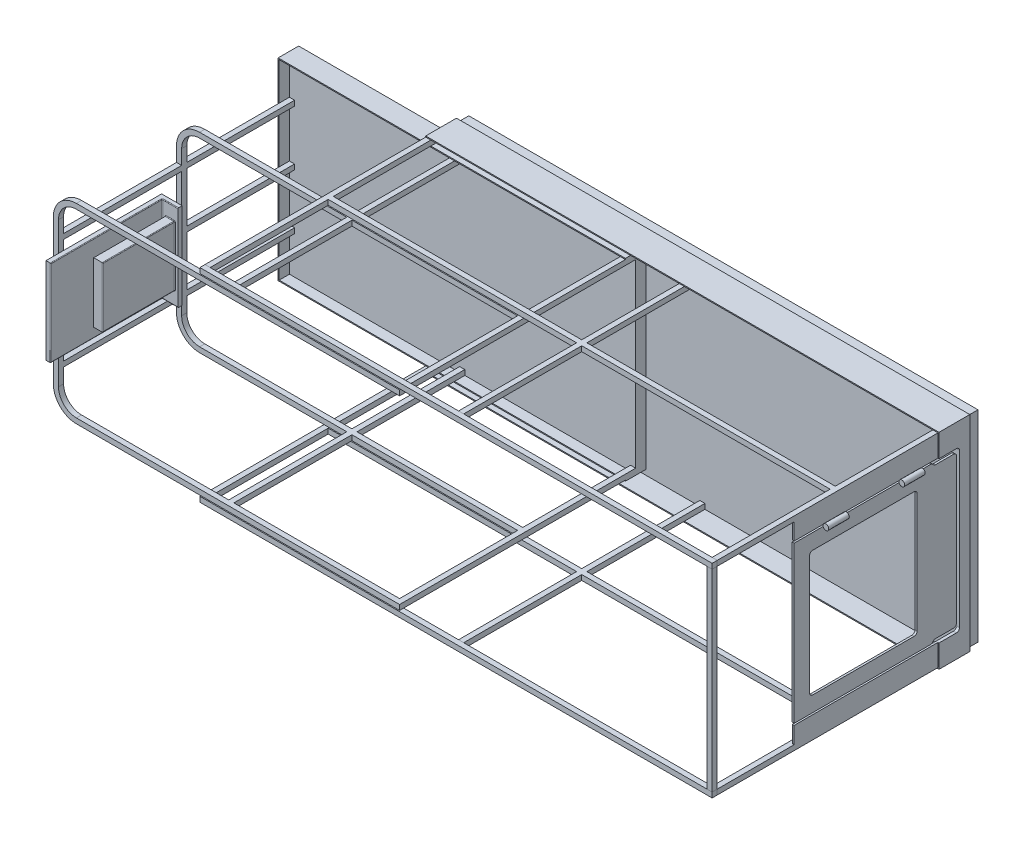
from build123d import *

# Parameters (mm, degrees)
SKETCH1_W             = 2500
SKETCH1_H             = 1000
BOSS_EXTRUDE1_DEPTH   = 150
SKETCH2_W             = 2500
SKETCH2_H             = 33.84
BOSS_EXTRUDE2_DEPTH   = 300
SKETCH6_R             = 20.5
CUT_EXTRUDE3_DEPTH    = 1386.534657235
CUT_EXTRUDE5_DEPTH    = 1386.534657235
SKETCH8_W             = 2490
SKETCH8_H             = 990
CUT_EXTRUDE6_DEPTH    = 100
SKETCH9_W             = 100
SKETCH9_H             = 990
CUT_EXTRUDE7_DEPTH    = 5
SKETCH10_W            = 25
SKETCH10_H            = 25
BOSS_EXTRUDE3_DEPTH   = 1200
SKETCH11_W            = 1691.4
SKETCH11_H            = 940
BOSS_EXTRUDE4_DEPTH   = 50
BOSS_EXTRUDE5_DEPTH   = 50
SKETCH13_W            = 25
SKETCH13_H            = 25
BOSS_EXTRUDE6_DEPTH   = 1150
SKETCH14_W            = 2495
SKETCH14_H            = 25
BOSS_EXTRUDE7_DEPTH   = 25
BOSS_EXTRUDE7_2_DEPTH = 25
BOSS_EXTRUDE7_3_DEPTH = 25
LPATTERN1_COUNT       = 2
LPATTERN1_PITCH       = 600
SKETCH15_W            = 9.58
SKETCH15_H            = 81.44
BOSS_EXTRUDE8_DEPTH   = 800
SKETCH16_W            = 100
SKETCH16_H            = 777.12
CUT_EXTRUDE8_DEPTH    = 800
SKETCH17_W            = 25
SKETCH17_H            = 25
BOSS_EXTRUDE9_DEPTH   = 940
SKETCH18_W            = 523.54
SKETCH18_H            = 610.12
BOSS_EXTRUDE10_DEPTH  = 10
SKETCH21_W            = 563.11
SKETCH21_H            = 420.31
BOSS_EXTRUDE12_DEPTH  = 100
BOSS_EXTRUDE13_REACH  = 2366.584
SKETCH22_W            = 25
SKETCH22_H            = 25
SKETCH23_W            = 77
SKETCH23_H            = 420.31
CUT_EXTRUDE9_DEPTH    = 543
SKETCH24_W            = 43.83
SKETCH24_H            = 293.34
BOSS_EXTRUDE14_DEPTH  = 351
SKETCH25_W            = 2480
SKETCH25_H            = 980
SKETCH25_W_2          = 2460
SKETCH25_H_2          = 960
BOSS_EXTRUDE15_DEPTH  = 50
SKETCH26_W            = 700.62
SKETCH26_H            = 904
CUT_EXTRUDE10_DEPTH   = 40
SKETCH27_R            = 14
BOSS_EXTRUDE16_DEPTH  = 100
LPATTERN4_COUNT       = 2
LPATTERN4_PITCH       = 370
CUT_EXTRUDE11_DEPTH   = 0.5
FILLET1_R             = 15
FILLET2_R             = 3
FILLET4_R             = 15
FILLET5_R             = 15
FILLET6_R             = 15


with BuildPart() as part:
    # Sketch1 → Boss-Extrude1 (new body)
    with BuildSketch(Plane.XY):
        Rectangle(SKETCH1_W, SKETCH1_H)
    extrude(amount=BOSS_EXTRUDE1_DEPTH)

    # Sketch2 → Boss-Extrude2 (add)
    with BuildSketch(Plane.XY):
        Rectangle(SKETCH2_W, SKETCH2_H)
    extrude(amount=-BOSS_EXTRUDE2_DEPTH)

    # Sketch6 → Cut-Extrude3 (cut, through all)
    with BuildSketch(Plane.XZ.offset(16.92)):
        with Locations(Location((1017.6, -85.12, 0), (0, 0, 270))):
            Circle(SKETCH6_R)
    extrude(amount=-CUT_EXTRUDE3_DEPTH, mode=Mode.SUBTRACT)

    # Sketch7 → Cut-Extrude5 (cut, through all)
    with BuildSketch(Plane.XZ.offset(16.92)):
        with BuildLine():
            Line((1114.79, 0), (1096.43282119, -57.416830165))
            ThreePointArc((1096.43282119, -57.416830165), (1071.200352307, -149.222118127), (976.378125269, -157.803122934))
            Line((976.378125269, -157.803122934), (756.61, 0))
            Line((756.61, 0), (-1250, 0))
            Line((-1250, 0), (-1250, -315.606245868))
            Line((-1250, -315.606245868), (1250, -315.606245868))
            Line((1250, -315.606245868), (1250, 0))
            Line((1250, 0), (1114.79, 0))
        make_face()
    extrude(amount=-CUT_EXTRUDE5_DEPTH, mode=Mode.SUBTRACT)

    # Sketch8 → Cut-Extrude6 (cut)
    with BuildSketch(Plane.XY.offset(150)):
        Rectangle(SKETCH8_W, SKETCH8_H)
    extrude(amount=-CUT_EXTRUDE6_DEPTH, mode=Mode.SUBTRACT)

    # Sketch9 → Cut-Extrude7 (cut)
    with BuildSketch(Plane.ZY.offset(1250)):
        with Locations((100, 0)):
            Rectangle(SKETCH9_W, SKETCH9_H)
    extrude(amount=-CUT_EXTRUDE7_DEPTH, mode=Mode.SUBTRACT)

    # Sketch10 → Boss-Extrude3 (add)
    with BuildSketch(Plane.XY.offset(50)):
        with Locations((-2.5, 482.5)):
            Rectangle(SKETCH10_W, SKETCH10_H)
        with Locations((-1237.5, 482.5)):
            Rectangle(SKETCH10_W, SKETCH10_H)
        with Locations((1232.5, 482.5)):
            Rectangle(SKETCH10_W, SKETCH10_H)
        with Locations((-2.5, -482.5)):
            Rectangle(SKETCH10_W, SKETCH10_H)
        with Locations((1232.5, -482.5)):
            Rectangle(SKETCH10_W, SKETCH10_H)
        with Locations((-1237.5, -482.5)):
            Rectangle(SKETCH10_W, SKETCH10_H)
    extrude(amount=BOSS_EXTRUDE3_DEPTH)

    # Sketch11 → Boss-Extrude4 (add)
    with BuildSketch(Plane.XY.offset(50)):
        with Locations((-1122.92, 0)):
            Rectangle(SKETCH11_W, SKETCH11_H)
    extrude(amount=BOSS_EXTRUDE4_DEPTH)

    # Sketch12 → Boss-Extrude5 (add)
    with BuildSketch(Plane.XY.offset(100)):
        Polygon((-1963.62, 465), (-277.22, 465), (-277.22, 470), (-1225, 470), (-1250, 470), (-1968.62, 470), (-1968.62, -470), (-1250, -470), (-1225, -470), (-277.22, -470), (-277.22, -465), (-1963.62, -465), align=None)
    extrude(amount=BOSS_EXTRUDE5_DEPTH)

    # Sketch13 → Boss-Extrude6 (add)
    with BuildSketch(Plane.XY.offset(100)):
        with Locations((-1121.92, 452.5)):
            Rectangle(SKETCH13_W, SKETCH13_H)
        with Locations((-289.72, 452.5)):
            Rectangle(SKETCH13_W, SKETCH13_H)
        with Locations((-1121.92, -452.5)):
            Rectangle(SKETCH13_W, SKETCH13_H)
        with Locations((-289.72, -452.5)):
            Rectangle(SKETCH13_W, SKETCH13_H)
        with Locations((-1951.12, -268.93)):
            Rectangle(SKETCH13_W, SKETCH13_H)
        with Locations((-1951.12, 268.93)):
            Rectangle(SKETCH13_W, SKETCH13_H)
    extrude(amount=BOSS_EXTRUDE6_DEPTH)



with BuildPart() as body_2:
    # Sketch14 → Boss-Extrude7 (new body)
    with BuildSketch(Plane.XY.offset(1250)):
        with Locations((-2.5, -482.5)):
            Rectangle(SKETCH14_W, SKETCH14_H)
    extrude(amount=-BOSS_EXTRUDE7_DEPTH)


with BuildPart() as body_3:
    # Sketch14 → Boss-Extrude7 2 (new body)
    with BuildSketch(Plane.XY.offset(1250)):
        with Locations((-2.5, 482.5)):
            Rectangle(SKETCH14_W, SKETCH14_H)
    extrude(amount=-BOSS_EXTRUDE7_2_DEPTH)


with BuildPart() as body_4:
    # Sketch14 → Boss-Extrude7 3 (new body)
    with BuildSketch(Plane.XY.offset(1250)):
        with BuildLine():
            Line((-277.22, 465), (-1851.12, 465))
            ThreePointArc((-1851.12, 465), (-1930.669512883, 432.049512883), (-1963.62, 352.5))
            Line((-1963.62, 352.5), (-1963.62, -352.5))
            ThreePointArc((-1963.62, -352.5), (-1930.669512883, -432.049512883), (-1851.12, -465))
            Line((-1851.12, -465), (-277.22, -465))
            Line((-277.22, -465), (-277.22, -440))
            Line((-277.22, -440), (-1851.12, -440))
            ThreePointArc((-1851.12, -440), (-1912.991843354, -414.371843354), (-1938.62, -352.5))
            Line((-1938.62, -352.5), (-1938.62, 352.5))
            ThreePointArc((-1938.62, 352.5), (-1912.991843354, 414.371843354), (-1851.12, 440))
            Line((-1851.12, 440), (-277.22, 440))
            Line((-277.22, 440), (-277.22, 465))
        make_face()
    extrude(amount=-BOSS_EXTRUDE7_3_DEPTH)


with BuildPart() as lpattern1_1:
    # LPattern1: pattern copy
    add(body_3.part.moved(Location(Vector(0, 0, -1) * (1 * LPATTERN1_PITCH))))


with BuildPart() as lpattern1_2:
    # LPattern1: pattern copy
    add(body_2.part.moved(Location(Vector(0, 0, -1) * (1 * LPATTERN1_PITCH))))


with BuildPart() as lpattern1_3:
    # LPattern1: pattern copy
    add(body_4.part.moved(Location(Vector(0, 0, -1) * (1 * LPATTERN1_PITCH))))


with BuildPart() as part_1:
    add(part.part)

    add(lpattern1_1.part)  # Boss-Extrude8 merges LPattern1_1

    add(lpattern1_2.part)  # Boss-Extrude8 merges LPattern1_2
    # Sketch15 → Boss-Extrude8 (add)
    with BuildSketch(Plane.XY.offset(50)):
        with Locations((1240.21, 429.28)):
            Rectangle(SKETCH15_W, SKETCH15_H)
        with Locations((1240.21, -429.28)):
            Rectangle(SKETCH15_W, SKETCH15_H)
    extrude(amount=BOSS_EXTRUDE8_DEPTH)

    # Sketch16 → Cut-Extrude8 (cut)
    with BuildSketch(Plane(origin=(1250, 0, 0), x_dir=(0, 0, -1), z_dir=(1, 0, 0))):
        with Locations((-100, 0)):
            Rectangle(SKETCH16_W, SKETCH16_H)
    extrude(amount=-CUT_EXTRUDE8_DEPTH, mode=Mode.SUBTRACT)


with BuildPart() as body_6:
    # Sketch17 → Boss-Extrude9 (new body)
    with BuildSketch(Plane.XZ.offset(-470)):
        with Locations((1232.5, 1237.5)):
            Rectangle(SKETCH17_W, SKETCH17_H)
    extrude(amount=BOSS_EXTRUDE9_DEPTH)


with BuildPart() as body_7:
    # Sketch18 → Boss-Extrude10 (new body)
    with BuildSketch(Plane(origin=(1245, 0, 0), x_dir=(0, 0, -1), z_dir=(1, 0, 0))):
        Polygon((-850, -380.06), (-850, 380.06), (-176.46, 380.06), (-176.46, 366.82), (-59.3, 366.82), (-59.3, -366.82), (-176.46, -366.82), (-176.46, -380.06), align=None)
        with Locations((-513.23, 0)):
            Rectangle(SKETCH18_W, SKETCH18_H, mode=Mode.SUBTRACT)
    extrude(amount=-BOSS_EXTRUDE10_DEPTH)

    # Fillet1
    fillet1_edges = [body_7.edges().sort_by_distance(p)[0] for p in [
        (1240, -305.06, 775),
        (1240, 305.06, 775),
        (1240, 305.06, 251.46),
        (1240, -305.06, 251.46),
    ]]
    fillet(fillet1_edges, radius=FILLET1_R)

    # Fillet4
    # the kernel refuses this fillet: 15 mm, written as the material it adds along each edge
    with BuildSketch(Plane(origin=(1245, -366.82, 176.46), x_dir=(0, 0, -1), z_dir=(-1, 0, 0))) as fillet4_piece_1:
        with BuildLine():
            CenterArc((14.896388824, 15), FILLET4_R, 186.738226521, 83.261773479)
            Line((0, 13.24), (0, 0))
            Line((0, 0), (14.896388824, 0))
        make_face()
    extrude(amount=10)
    with BuildSketch(Plane(origin=(1245, 366.82, 176.46), x_dir=(0, 1, 0), z_dir=(-1, 0, 0))) as fillet4_piece_2:
        with BuildLine():
            CenterArc((15, 14.896388824), FILLET4_R, 180, 83.261773479)
            Line((0, 14.896388824), (0, 0))
            Line((0, 0), (13.24, 0))
        make_face()
    extrude(amount=10)
    # the kernel refuses this fillet: 15 mm, written as the material it takes off along each edge
    with BuildSketch(Plane(origin=(1282.5, -366.82, 59.3), x_dir=(0, 1, 0), z_dir=(-1, 0, 0)), Plane(origin=(1282.5, 366.82, 59.3), x_dir=(0, 0, 1), z_dir=(-1, 0, 0))) as fillet4_2_piece_1:
        with BuildLine():
            CenterArc((FILLET4_R, -FILLET4_R), FILLET4_R, 90, 90)
            Line((0, -FILLET4_R), (0, 0))
            Line((0, 0), (FILLET4_R, 0))
        make_face()
    extrude(amount=85, mode=Mode.SUBTRACT)

    # Fillet5
    fillet5_edges = [body_7.edges().sort_by_distance(p)[0] for p in [
        (1240, 380.06, 176.46),
        (1240, -380.06, 176.46),
    ]]
    fillet(fillet5_edges, radius=FILLET5_R)


with BuildPart() as body_4_1:
    add(body_4.part)

    add(part_1.part)  # Boss-Extrude12 merges part
    # Sketch21 → Boss-Extrude12 (add)
    with BuildSketch(Plane(origin=(-1938.62, 0, 0), x_dir=(0, 0, -1), z_dir=(1, 0, 0))):
        with Locations((-1029.145, 0)):
            Rectangle(SKETCH21_W, SKETCH21_H)
    extrude(amount=BOSS_EXTRUDE12_DEPTH)

    # Boss-Extrude13: up to this face of the body (flat: up to its plane)
    boss_extrude13_end = Plane(body_4_1.part.faces().sort_by_distance((-1951.12, 0, 1225))[0])
    # Sketch22 → Boss-Extrude13 (add, up to the picked face)
    with BuildSketch(Plane.XY.offset(100), mode=Mode.PRIVATE) as boss_extrude13_sk1:
        with Locations((-1951.12, 0)):
            Rectangle(SKETCH22_W, SKETCH22_H)
    boss_extrude13_tool1 = split(extrude(boss_extrude13_sk1.sketch, amount=BOSS_EXTRUDE13_REACH, mode=Mode.PRIVATE), bisect_by=boss_extrude13_end, keep=Keep.BOTH, mode=Mode.PRIVATE)

    add(lpattern1_3.part)  # Boss-Extrude13 merges LPattern1_3
    add(boss_extrude13_tool1.solids().sort_by(Axis((-1951.12, 0, 100), (0, 0, 1)))[0])

    # Sketch23 → Cut-Extrude9 (cut)
    with BuildSketch(Plane.XY.offset(1310.7)):
        with Locations((-1877.12, 0)):
            Rectangle(SKETCH23_W, SKETCH23_H)
    extrude(amount=-CUT_EXTRUDE9_DEPTH, mode=Mode.SUBTRACT)

    # Sketch24 → Boss-Extrude14 (add)
    with BuildSketch(Plane.XY.offset(767.7)):
        with Locations((-1876.165, 0)):
            Rectangle(SKETCH24_W, SKETCH24_H)
    extrude(amount=BOSS_EXTRUDE14_DEPTH)

    # Sketch25 → Boss-Extrude15 (add)
    with BuildSketch(Plane(origin=(0, 0, 0), x_dir=(-1, 0, 0), z_dir=(0, 0, -1))):
        Rectangle(SKETCH25_W, SKETCH25_H)
        Rectangle(SKETCH25_W_2, SKETCH25_H_2, mode=Mode.SUBTRACT)
    extrude(amount=BOSS_EXTRUDE15_DEPTH)

    # Sketch26 → Cut-Extrude10 (cut)
    with BuildSketch(Plane(origin=(0, 0, 50), x_dir=(-1, 0, 0), z_dir=(0, 0, -1))):
        with Locations((1600.31, 0)):
            Rectangle(SKETCH26_W, SKETCH26_H)
    extrude(amount=-CUT_EXTRUDE10_DEPTH, mode=Mode.SUBTRACT)

    # Sketch28 → Cut-Extrude11 (cut)
    # profile 1 of 9: a face of its own
    with BuildSketch(Plane.XZ.offset(500)):
        Polygon((-327.798568993, 18.363528097), (-381.868436044, 18.363528097), (-346.955353921, 121.096275493), (-295.588980223, 121.096275493), (-299.264041499, 110.282302083), (-338.464695111, 110.282302083), (-349.954541859, 76.488635176), (-313.4573816, 76.488635176), (-317.132442876, 65.674661766), (-353.629603135, 65.674661766), (-366.027654681, 29.177501507), (-324.123507717, 29.177501507), align=None)
    # profile 2 of 9: a face of its own
    with BuildSketch(Plane.XZ.offset(500)):
        with BuildLine():
            Line((-225.065821597, 18.363528097), (-239.597098367, 18.363528097))
            Line((-239.597098367, 18.363528097), (-264.372080418, 100.24980722))
            add(Edge.make_bspline(
                [(-264.372080418, 100.24980722), (-264.659267786, 101.292930622), (-265.240455097, 103.40392209), (-265.407164078, 105.587259781), (-265.491495634, 106.691724974)],
                knots=[0, 0, 0, 0, 0.988278179, 2, 2, 2, 2], degree=3))
            Line((-265.491495634, 106.691724974), (-265.913916471, 106.691724974))
            add(Edge.make_bspline(
                [(-265.913916471, 106.691724974), (-265.975096946, 106.374445666), (-266.111621847, 105.666433421), (-266.395331864, 104.49039508), (-266.774203208, 103.081466348), (-267.268587481, 101.43837372), (-267.832723165, 99.554484788), (-268.516427562, 97.437598882), (-269.29371694, 95.087034578), (-269.848593283, 93.441500203), (-270.138124834, 92.582869041)],
                knots=[0, 0, 0, 0, 0.52615285, 1.174115837, 1.969525155, 2.901881659, 3.968209619, 5.172004094, 6.524366645, 8, 8, 8, 8], degree=3))
            Line((-270.138124834, 92.582869041), (-295.356648763, 18.363528097))
            Line((-295.356648763, 18.363528097), (-307.522368849, 18.363528097))
            Line((-307.522368849, 18.363528097), (-272.609286727, 121.096275493))
            Line((-272.609286727, 121.096275493), (-257.233168284, 121.096275493))
            Line((-257.233168284, 121.096275493), (-233.429754157, 40.498379921))
            add(Edge.make_bspline(
                [(-233.429754157, 40.498379921), (-233.204080764, 39.72410335), (-232.794402226, 38.318512335), (-232.242213701, 36.40416064), (-231.892372317, 34.876725102), (-231.710663311, 33.98630735), (-231.634465602, 33.612920289)],
                knots=[0, 0, 0, 0, 1.359559091, 2.468089715, 3.357609976, 4, 4, 4, 4], degree=3))
            Line((-231.634465602, 33.612920289), (-231.338771017, 33.612920289))
            add(Edge.make_bspline(
                [(-231.338771017, 33.612920289), (-231.254702446, 34.014292042), (-231.071542348, 34.888760219), (-230.766817971, 36.296428669), (-230.331833016, 37.892459626), (-229.797994125, 39.674960866), (-229.20756035, 41.669780987), (-228.542170855, 43.858080401), (-227.745276952, 46.230638781), (-227.192032351, 47.876686965), (-226.903352235, 48.735586229)],
                knots=[0, 0, 0, 0, 0.624089439, 1.359702942, 2.191339226, 3.140609173, 4.191463313, 5.357281308, 6.621043318, 8, 8, 8, 8], degree=3))
            Line((-226.903352235, 48.735586229), (-202.318459561, 121.096275493))
            Line((-202.318459561, 121.096275493), (-190.152739475, 121.096275493))
            Line((-190.152739475, 121.096275493), (-225.065821597, 18.363528097))
        make_face()
    # profile 3 of 9: a face of its own
    with BuildSketch(Plane.XZ.offset(500)):
        with BuildLine():
            add(Edge.make_bspline(
                [(-118.446802507, 25.798134817), (-119.989553586, 25.101096834), (-123.045632926, 23.720314536), (-127.698393911, 21.913896752), (-132.375186877, 20.42865101), (-137.047539178, 19.157770084), (-141.750759162, 18.223319628), (-146.463545788, 17.509431763), (-151.19861115, 17.109681053), (-154.358935816, 17.044380932), (-155.936651732, 17.011781421)],
                knots=[0, 0, 0, 0, 1.046503394, 2.073048235, 3.083381765, 4.078982208, 5.064897693, 6.046084493, 7.024554779, 8, 8, 8, 8], degree=3))
            add(Edge.make_bspline(
                [(-155.936651732, 17.011781421), (-157.706343651, 17.044908094), (-161.125944393, 17.108919233), (-166.048489175, 17.808013445), (-170.570819757, 18.875813802), (-174.67805569, 20.426203884), (-178.363455286, 22.425962589), (-181.667638236, 24.845069008), (-184.514161293, 27.754351879), (-186.930390113, 31.063689796), (-188.875618915, 34.73399261), (-190.331819994, 38.717232848), (-191.199662863, 43.002785456), (-191.569920201, 47.552538893), (-191.440087073, 52.383741324), (-190.725721089, 57.482605944), (-189.549066631, 62.877103517), (-188.388710065, 66.500033248), (-187.787182791, 68.378155119)],
                knots=[0, 0, 0, 0, 1.145727479, 2.213905423, 3.213937247, 4.150816045, 5.048830035, 5.922741085, 6.79355205, 7.674811601, 8.568506405, 9.476060275, 10.412628158, 11.392135865, 12.427851946, 13.536708376, 14.723032955, 16, 16, 16, 16], degree=3))
            add(Edge.make_bspline(
                [(-187.787182791, 68.378155119), (-187.084532651, 70.319157924), (-185.688969334, 74.17426612), (-183.087283, 79.710491429), (-180.136305622, 84.99822794), (-176.749861084, 89.977308501), (-173.059118441, 94.743484245), (-168.934264817, 99.200868647), (-164.452890272, 103.416756611), (-159.617758915, 107.309406779), (-154.574957887, 110.859786029), (-149.384479399, 113.964870897), (-144.088847069, 116.567026022), (-138.708832762, 118.70993262), (-133.244702436, 120.395225836), (-127.687784936, 121.567430339), (-122.044135817, 122.322653541), (-118.245026118, 122.406074924), (-116.334698326, 122.448022169)],
                knots=[0, 0, 0, 0, 1.037794143, 2.061207072, 3.072745994, 4.080409893, 5.086978139, 6.101957343, 7.131581733, 8.179021257, 9.221336507, 10.231262643, 11.217875689, 12.185807071, 13.141273563, 14.089990349, 15.039579057, 16, 16, 16, 16], degree=3))
            add(Edge.make_bspline(
                [(-116.334698326, 122.448022169), (-114.982535144, 122.432638955), (-112.346129586, 122.402645245), (-108.504442123, 122.14612038), (-104.886748809, 121.73139346), (-101.494062885, 121.141015797), (-98.323313233, 120.388900392), (-95.379236262, 119.459529177), (-92.651484464, 118.372248178), (-90.968242812, 117.478406238), (-90.144606473, 117.041035464)],
                knots=[0, 0, 0, 0, 1.200608489, 2.340908951, 3.417256136, 4.43274759, 5.397149215, 6.308649776, 7.17239601, 8, 8, 8, 8], degree=3))
            Line((-90.144606473, 117.041035464), (-94.748993589, 103.523568702))
            add(Edge.make_bspline(
                [(-94.748993589, 103.523568702), (-95.5795953, 104.177656436), (-97.259200359, 105.500322949), (-100.070757602, 107.125311725), (-103.086057062, 108.532955219), (-106.335237258, 109.669669152), (-109.812737996, 110.554882692), (-113.514396966, 111.178116), (-117.445777239, 111.567403488), (-120.142577436, 111.61140405), (-121.530474613, 111.634048759)],
                knots=[0, 0, 0, 0, 0.887592316, 1.794848874, 2.721427991, 3.681505874, 4.683258219, 5.73388828, 6.833754884, 8, 8, 8, 8], degree=3))
            add(Edge.make_bspline(
                [(-121.530474613, 111.634048759), (-122.961307742, 111.595748722), (-125.812295604, 111.519434483), (-130.048499232, 110.958635185), (-134.208097564, 110.020902999), (-138.298374014, 108.725865408), (-142.328102885, 107.072074378), (-146.286101722, 105.039115222), (-150.156851702, 102.610263443), (-153.935488356, 99.861573611), (-157.543802043, 96.820732809), (-160.911129917, 93.538890502), (-164.013280196, 90.044671065), (-166.817783385, 86.310134386), (-169.389321448, 82.385524101), (-171.644824452, 78.214552699), (-173.671203554, 73.847651562), (-174.770883744, 70.802023389), (-175.325768119, 69.265238875)],
                knots=[0, 0, 0, 0, 0.941049283, 1.875075456, 2.805374253, 3.742769849, 4.69395225, 5.667432974, 6.665929008, 7.696932075, 8.738778738, 9.767126039, 10.787464568, 11.809105514, 12.836733016, 13.870893261, 14.925680326, 16, 16, 16, 16], degree=3))
            add(Edge.make_bspline(
                [(-175.325768119, 69.265238875), (-175.826114773, 67.701489892), (-176.789258267, 64.691347526), (-177.834643407, 60.238535046), (-178.466821013, 56.042312248), (-178.666304569, 52.093294996), (-178.465460064, 48.395104934), (-177.869804924, 44.945688309), (-176.822894822, 41.761538157), (-175.382883127, 38.850126626), (-173.566687562, 36.229999255), (-171.356120498, 33.971255948), (-168.815919345, 32.040777309), (-165.90453618, 30.503213361), (-162.665791115, 29.297698795), (-159.08460656, 28.443728367), (-155.157349971, 27.906435738), (-152.418341762, 27.853352746), (-150.994327947, 27.825754831)],
                knots=[0, 0, 0, 0, 1.327796452, 2.555944975, 3.695653753, 4.756226598, 5.748851203, 6.686163175, 7.579478843, 8.450568193, 9.305343847, 10.147118353, 10.996870125, 11.875965912, 12.80052522, 13.785424109, 14.848639207, 16, 16, 16, 16], degree=3))
            add(Edge.make_bspline(
                [(-150.994327947, 27.825754831), (-149.987251856, 27.845410603), (-147.992101647, 27.884351273), (-145.022618462, 28.091742969), (-142.102021207, 28.469609124), (-139.237679291, 29.030678137), (-136.410745591, 29.694354706), (-133.645107915, 30.55205537), (-130.91758813, 31.531301434), (-129.150800291, 32.313778416), (-128.268086952, 32.704715491)],
                knots=[0, 0, 0, 0, 1.031786621, 2.044105021, 3.04785698, 4.046517148, 5.03315035, 6.02104813, 7.011286374, 8, 8, 8, 8], degree=3))
            Line((-128.268086952, 32.704715491), (-118.446802507, 61.619421738))
            Line((-118.446802507, 61.619421738), (-141.426496004, 61.619421738))
            Line((-141.426496004, 61.619421738), (-137.751434728, 72.433395148))
            Line((-137.751434728, 72.433395148), (-102.606021145, 72.433395148))
            Line((-102.606021145, 72.433395148), (-118.446802507, 25.798134817))
        make_face()
    # profile 4 of 9: a face of its own
    with BuildSketch(Plane.XZ.offset(500)):
        Polygon((-49.106422224, 54.860688356), (-88.307075835, 54.860688356), (-85.075556437, 64.32291509), (-45.874902826, 64.32291509), align=None)
    # profile 5 of 9: a face of its own
    with BuildSketch(Plane.XZ.offset(500)):
        Polygon((39.200653612, 18.363528097), (27.034933525, 18.363528097), (26.063365602, 46.750208299), (-20.297321186, 46.750208299), (-40.552400288, 18.363528097), (-52.718120374, 18.363528097), (22.029246615, 121.096275493), (34.427298161, 121.096275493), align=None)
        with BuildLine():
            Line((25.704307891, 57.564181709), (24.246956005, 101.664917022))
            add(Edge.make_bspline(
                [(24.246956005, 101.664917022), (24.159148963, 102.100064297), (23.962350373, 103.075343359), (23.894662926, 104.734218679), (23.891333402, 106.720922671), (23.97142004, 108.156241151), (24.014624545, 108.930555407)],
                knots=[0, 0, 0, 0, 0.729555052, 1.635124029, 2.724215425, 4, 4, 4, 4], degree=3))
            Line((24.014624545, 108.930555407), (23.507719542, 108.930555407))
            add(Edge.make_bspline(
                [(23.507719542, 108.930555407), (23.04832745, 108.166877411), (22.161064421, 106.69192113), (20.784300721, 104.599965915), (19.521355371, 102.639695873), (18.660540217, 101.409033246), (18.24858013, 100.820075349)],
                knots=[0, 0, 0, 0, 1.106008716, 2.136128724, 3.108007602, 4, 4, 4, 4], degree=3))
            Line((18.24858013, 100.820075349), (-12.355809463, 57.564181709))
            Line((-12.355809463, 57.564181709), (25.704307891, 57.564181709))
        make_face(mode=Mode.SUBTRACT)
    # profile 6 of 9: a face of its own
    with BuildSketch(Plane.XZ.offset(500)):
        with BuildLine():
            Line((158.830234461, 18.363528097), (146.664514374, 18.363528097))
            Line((146.664514374, 18.363528097), (170.087749749, 87.281487545))
            add(Edge.make_bspline(
                [(170.087749749, 87.281487545), (170.593073735, 88.720912212), (171.664034644, 91.771564059), (173.54202822, 96.529479229), (175.689433508, 101.76338336), (177.294438786, 105.372272678), (178.134866681, 107.261993103)],
                knots=[0, 0, 0, 0, 0.849535399, 1.800467084, 2.848259974, 4, 4, 4, 4], degree=3))
            Line((178.134866681, 107.261993103), (177.860293137, 107.261993103))
            add(Edge.make_bspline(
                [(177.860293137, 107.261993103), (177.224791628, 106.181708583), (176.045516446, 104.17706704), (174.334665855, 101.439422374), (172.825127882, 99.199875527), (171.85201963, 97.895326106), (171.418375383, 97.313982408)],
                knots=[0, 0, 0, 0, 1.268187614, 2.353325931, 3.266195992, 4, 4, 4, 4], degree=3))
            Line((171.418375383, 97.313982408), (109.702691195, 18.363528097))
            Line((109.702691195, 18.363528097), (103.873283654, 18.363528097))
            Line((103.873283654, 18.363528097), (95.699440471, 96.722593237))
            add(Edge.make_bspline(
                [(95.699440471, 96.722593237), (95.663670708, 97.370108252), (95.583612562, 98.819344884), (95.640574006, 101.232373486), (95.868394338, 104.097717495), (96.0883501, 106.157188755), (96.206345475, 107.261993103)],
                knots=[0, 0, 0, 0, 0.736275955, 1.647897054, 2.738213243, 4, 4, 4, 4], degree=3))
            Line((96.206345475, 107.261993103), (95.910650889, 107.261993103))
            add(Edge.make_bspline(
                [(95.910650889, 107.261993103), (95.824331312, 106.704867916), (95.638839264, 105.507662187), (95.224000982, 103.600588523), (94.6900986, 101.45611777), (94.065556045, 99.055230275), (93.258779548, 96.428270859), (92.418479112, 93.527301984), (91.386413148, 90.411122098), (90.666031342, 88.252871682), (90.292453766, 87.133640252)],
                knots=[0, 0, 0, 0, 0.646620608, 1.389522345, 2.237703454, 3.181957595, 4.234812037, 5.389772674, 6.646381142, 8, 8, 8, 8], degree=3))
            Line((90.292453766, 87.133640252), (66.911460475, 18.363528097))
            Line((66.911460475, 18.363528097), (54.745740389, 18.363528097))
            Line((54.745740389, 18.363528097), (89.658822511, 121.096275493))
            Line((89.658822511, 121.096275493), (106.112114086, 121.096275493))
            Line((106.112114086, 121.096275493), (112.680758091, 49.453701651))
            add(Edge.make_bspline(
                [(112.680758091, 49.453701651), (112.801948994, 48.165940316), (113.027545985, 45.768771262), (113.217508203, 42.430155306), (113.290010586, 39.609712976), (113.190338004, 37.907313009), (113.145421011, 37.140134272)],
                knots=[0, 0, 0, 0, 1.258025584, 2.341815922, 3.252746951, 4, 4, 4, 4], degree=3))
            Line((113.145421011, 37.140134272), (113.567841848, 37.140134272))
            add(Edge.make_bspline(
                [(113.567841848, 37.140134272), (114.045393355, 37.823889215), (114.968143333, 39.14507625), (116.326410104, 41.048420986), (117.592540552, 42.823396835), (118.776067208, 44.470313069), (119.868441455, 45.988294066), (120.885587028, 47.371178169), (121.831283537, 48.603306004), (122.431568122, 49.383356067), (122.713252954, 49.749396237)],
                knots=[0, 0, 0, 0, 1.284879824, 2.482711944, 3.602367276, 4.643851528, 5.607171796, 6.483588369, 7.288420582, 8, 8, 8, 8], degree=3))
            Line((122.713252954, 49.749396237), (178.515045434, 121.096275493))
            Line((178.515045434, 121.096275493), (193.743316583, 121.096275493))
            Line((193.743316583, 121.096275493), (158.830234461, 18.363528097))
        make_face()
    # profile 7 of 9: a face of its own
    with BuildSketch(Plane.XZ.offset(500)):
        Polygon((242.406196929, 121.096275493), (238.731135653, 110.282302083), (229.268908919, 110.282302083), (201.705949348, 29.177501507), (211.168176082, 29.177501507), (207.493114806, 18.363528097), (176.402941252, 18.363528097), (180.078002528, 29.177501507), (189.540229262, 29.177501507), (217.103188833, 110.282302083), (207.640962099, 110.282302083), (211.316023375, 121.096275493), align=None)
    # profile 8 of 9: a face of its own
    with BuildSketch(Plane.XZ.offset(500)):
        with BuildLine():
            Line((307.522368849, 18.363528097), (292.99109208, 18.363528097))
            Line((292.99109208, 18.363528097), (268.216110029, 100.24980722))
            add(Edge.make_bspline(
                [(268.216110029, 100.24980722), (267.92892266, 101.292930622), (267.34773535, 103.40392209), (267.181026369, 105.587259781), (267.096694812, 106.691724974)],
                knots=[0, 0, 0, 0, 0.988278179, 2, 2, 2, 2], degree=3))
            Line((267.096694812, 106.691724974), (266.674273976, 106.691724974))
            add(Edge.make_bspline(
                [(266.674273976, 106.691724974), (266.6130935, 106.374445666), (266.4765686, 105.666433421), (266.192858583, 104.49039508), (265.813987239, 103.081466348), (265.319602966, 101.43837372), (264.755467281, 99.554484788), (264.071762885, 97.437598882), (263.294473506, 95.087034578), (262.739597163, 93.441500203), (262.450065613, 92.582869041)],
                knots=[0, 0, 0, 0, 0.52615285, 1.174115837, 1.969525155, 2.901881659, 3.968209619, 5.172004094, 6.524366645, 8, 8, 8, 8], degree=3))
            Line((262.450065613, 92.582869041), (237.231541684, 18.363528097))
            Line((237.231541684, 18.363528097), (225.065821597, 18.363528097))
            Line((225.065821597, 18.363528097), (259.97890372, 121.096275493))
            Line((259.97890372, 121.096275493), (275.355022163, 121.096275493))
            Line((275.355022163, 121.096275493), (299.15843629, 40.498379921))
            add(Edge.make_bspline(
                [(299.15843629, 40.498379921), (299.384109683, 39.72410335), (299.79378822, 38.318512335), (300.345976746, 36.40416064), (300.69581813, 34.876725102), (300.877527136, 33.98630735), (300.953724844, 33.612920289)],
                knots=[0, 0, 0, 0, 1.359559091, 2.468089715, 3.357609976, 4, 4, 4, 4], degree=3))
            Line((300.953724844, 33.612920289), (301.24941943, 33.612920289))
            add(Edge.make_bspline(
                [(301.24941943, 33.612920289), (301.333488001, 34.014292042), (301.516648099, 34.888760219), (301.821372475, 36.296428669), (302.25635743, 37.892459626), (302.790196321, 39.674960866), (303.380630097, 41.669780987), (304.046019591, 43.858080401), (304.842913495, 46.230638781), (305.396158095, 47.876686965), (305.684838211, 48.735586229)],
                knots=[0, 0, 0, 0, 0.624089439, 1.359702942, 2.191339226, 3.140609173, 4.191463313, 5.357281308, 6.621043318, 8, 8, 8, 8], degree=3))
            Line((305.684838211, 48.735586229), (330.269730886, 121.096275493))
            Line((330.269730886, 121.096275493), (342.435450972, 121.096275493))
            Line((342.435450972, 121.096275493), (307.522368849, 18.363528097))
        make_face()
    # profile 9 of 9: a face of its own
    with BuildSketch(Plane.XZ.offset(500)):
        Polygon((388.627169425, 18.363528097), (334.557302375, 18.363528097), (369.470384497, 121.096275493), (420.836758195, 121.096275493), (417.161696919, 110.282302083), (377.961043308, 110.282302083), (366.471196559, 76.488635176), (402.968356818, 76.488635176), (399.293295542, 65.674661766), (362.796135283, 65.674661766), (350.398083737, 29.177501507), (392.302230701, 29.177501507), align=None)
    extrude(amount=-CUT_EXTRUDE11_DEPTH, mode=Mode.SUBTRACT)

    # Fillet2
    fillet2_edges = [body_4_1.edges().sort_by_distance(p)[0] for p in [
        (-1877.12, -210.155, 767.7),
        (-1915.62, 0, 767.7),
        (-1915.62, -210.155, 1039.2),
        (-1877.12, 210.155, 767.7),
        (-1915.62, 210.155, 1039.2),
        (-1915.62, 0, 1310.7),
        (-1876.165, -146.67, 767.7),
        (-1854.25, 0, 767.7),
        (-1854.25, -146.67, 943.2),
        (-1876.165, 146.67, 767.7),
        (-1854.25, 146.67, 943.2),
        (-1854.25, 0, 1118.7),
    ]]
    fillet(fillet2_edges, radius=FILLET2_R)

    # Fillet6
    fillet6_edges = [body_4_1.edges().sort_by_distance(p)[0] for p in [
        (1242.71, 388.56, 50),
        (1242.71, -388.56, 50),
    ]]
    fillet(fillet6_edges, radius=FILLET6_R)


with BuildPart() as body_6_2:
    # Sketch27 → Boss-Extrude16 (new body)
    with BuildSketch(Plane.XY.offset(710)):
        with Locations((1259, 384.31)):
            Circle(SKETCH27_R)
    extrude(amount=-BOSS_EXTRUDE16_DEPTH)


with BuildPart() as lpattern4_1:
    # LPattern4: pattern copy
    add(body_6_2.part.moved(Location(Vector(0, 0, -1) * (1 * LPATTERN4_PITCH))))


solid = Compound([body_2.part, body_3.part, body_6.part, body_7.part, body_4_1.part, body_6_2.part, lpattern4_1.part])
